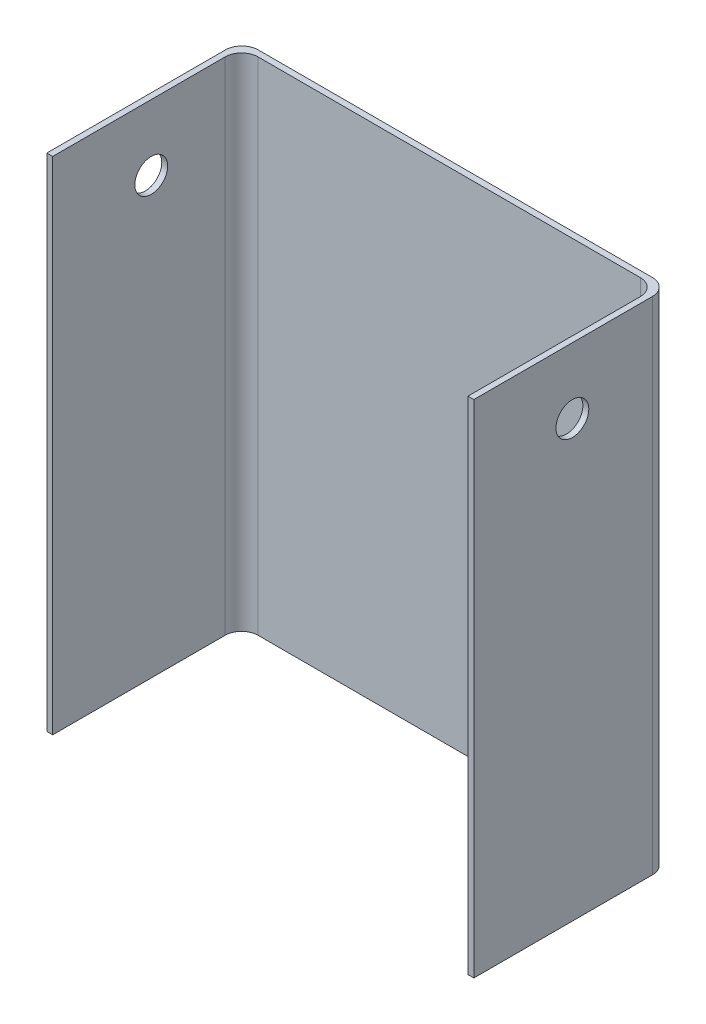
from build123d import *

# Parameters (mm, degrees)
SKETCH1_W           = 66.04
SKETCH1_H           = 77.47
BOSS_EXTRUDE1_DEPTH = 30.1625
SKETCH2_W           = 64.21628
SKETCH2_H           = 77.47
CUT_EXTRUDE2_DEPTH  = 29.21
FILLET1_R           = 2.54
FILLET2_R           = 2.54
FILLET3_R           = 2.54
FILLET4_R           = 2.54
SKETCH5_R           = 2.54
CUT_EXTRUDE3_DEPTH  = 94.650885895


with BuildPart() as part:
    # Sketch1 → Boss-Extrude1 (new body)
    with BuildSketch(Plane.XY):
        with Locations((54.726493431, 20.420983827)):
            Rectangle(SKETCH1_W, SKETCH1_H)
    extrude(amount=BOSS_EXTRUDE1_DEPTH)

    # Sketch2 → Cut-Extrude2 (cut)
    with BuildSketch(Plane.XY.offset(30.1625)):
        with Locations((54.726493431, 20.420983827)):
            Rectangle(SKETCH2_W, SKETCH2_H)
    extrude(amount=-CUT_EXTRUDE2_DEPTH, mode=Mode.SUBTRACT)

    # Fillet1
    fillet1_edges = [part.edges().sort_by_distance(p)[0] for p in [
        (21.706493431, 20.420983827, 0),
    ]]
    fillet(fillet1_edges, radius=FILLET1_R)

    # Fillet2
    fillet2_edges = [part.edges().sort_by_distance(p)[0] for p in [
        (87.746493431, 20.420983827, 0),
    ]]
    fillet(fillet2_edges, radius=FILLET2_R)

    # Fillet3
    fillet3_edges = [part.edges().sort_by_distance(p)[0] for p in [
        (22.618353431, 20.420983827, 0.9525),
    ]]
    fillet(fillet3_edges, radius=FILLET3_R)

    # Fillet4
    fillet4_edges = [part.edges().sort_by_distance(p)[0] for p in [
        (86.834633431, 20.420983827, 0.9525),
    ]]
    fillet(fillet4_edges, radius=FILLET4_R)

    # Sketch5 → Cut-Extrude3 (cut, through all)
    with BuildSketch(Plane.ZY.offset(-21.706493431)):
        with Locations((14.9225, 48.995983827)):
            Circle(SKETCH5_R)
    extrude(amount=-CUT_EXTRUDE3_DEPTH, mode=Mode.SUBTRACT)


solid = part.part
